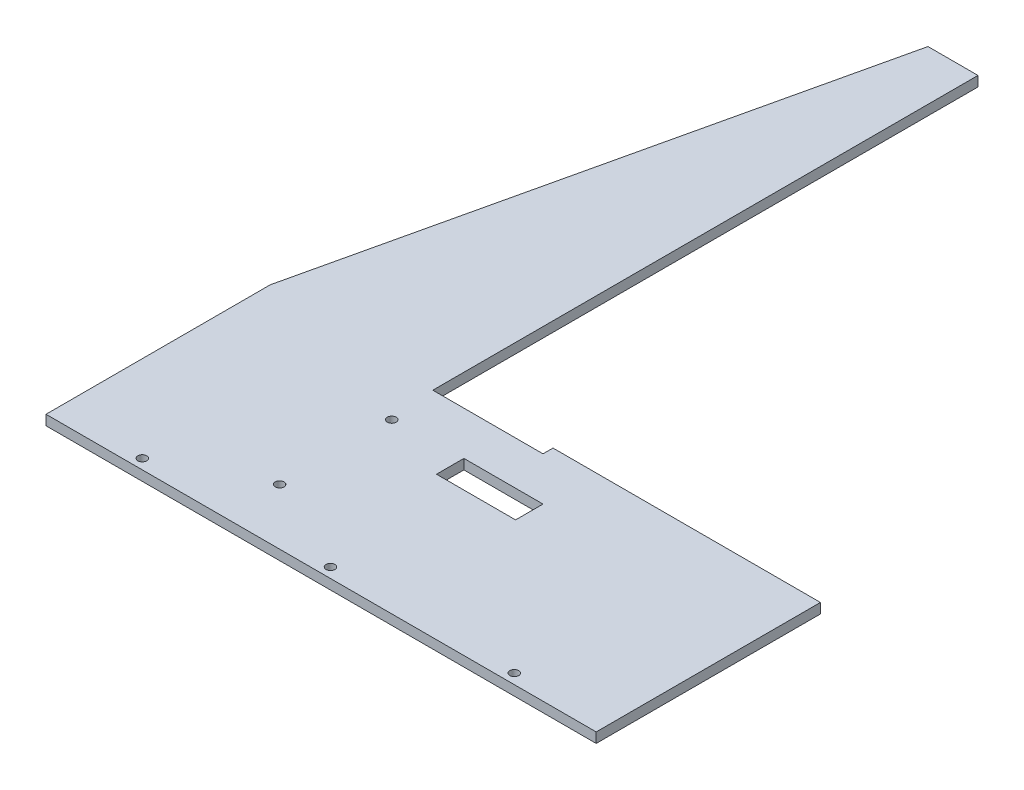
from build123d import *

# Parameters (mm, degrees)
LEG_OUTLINE_R = 2.65
LEG_OUTLINE_W = 47.454147397
LEG_OUTLINE_H = 16.449498304
LEG_DEPTH     = 6


# Read off the part's stored shape, not the designer's step: leg
with BuildPart() as part:
    # leg outline → leg (new body)
    with BuildSketch(Plane(origin=(0, 0, 0), x_dir=(1, 0, 0), z_dir=(0, 1, 0))):
        Polygon((0, 0), (330, 0), (330, 134.5), (169.6, 134.5), (169.6, 128.5), (103.5, 128.5), (103.5, 455.5), (73.5, 455.5), (0, 134.5), align=None)
        with Locations((51.75, 6)):
            Circle(LEG_OUTLINE_R, mode=Mode.SUBTRACT)
        with Locations((106.5, 33.625)):
            Circle(LEG_OUTLINE_R, mode=Mode.SUBTRACT)
        with Locations((164.625, 6)):
            Circle(LEG_OUTLINE_R, mode=Mode.SUBTRACT)
        with Locations((106.5, 100.875)):
            Circle(LEG_OUTLINE_R, mode=Mode.SUBTRACT)
        with Locations((171.976991955, 94.176840096)):
            Rectangle(LEG_OUTLINE_W, LEG_OUTLINE_H, mode=Mode.SUBTRACT)
        with Locations((274.875, 6)):
            Circle(LEG_OUTLINE_R, mode=Mode.SUBTRACT)
    extrude(amount=LEG_DEPTH)


solid = part.part
